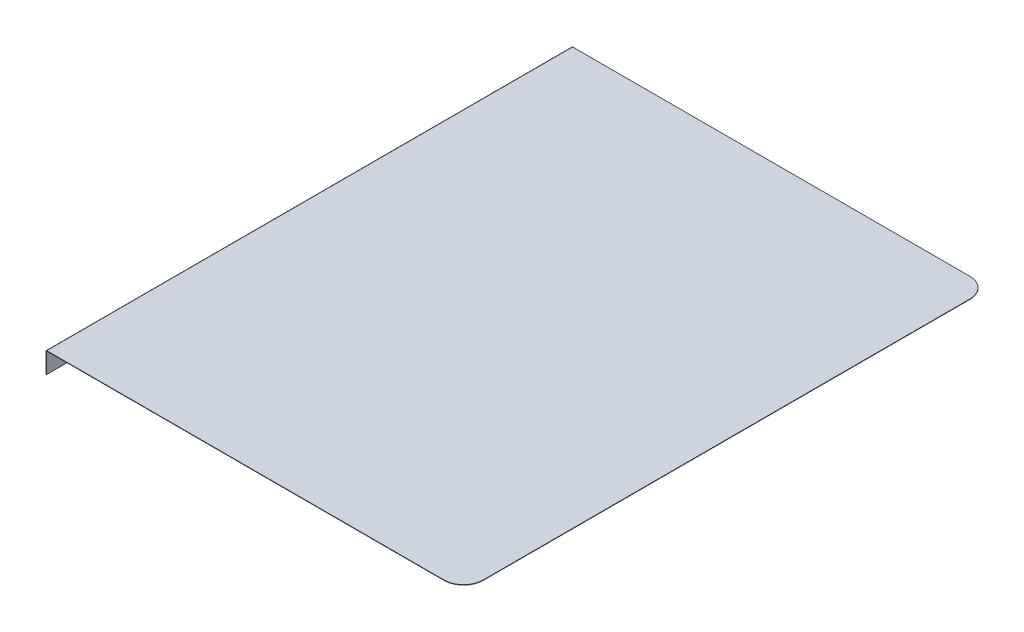
from build123d import *

# Parameters (mm, degrees)
SKETCH1_W                    = 810
SKETCH1_H                    = 1020
BASE_FLANGE1_DEPTH           = 0.8
EDGE_FLANGE1_STRIP_W         = 4.8
EDGE_FLANGE1_STRIP_H         = 0.8
EDGE_FLANGE1_STRIP_CUT_DEPTH = 1020
EDGE_FLANGE1_DEPTH           = 1020
CUT_EXTRUDE2_DEPTH           = 10


# Sheet-metal steps are written as plain solids
with BuildPart() as part:
    # Sketch1 → Base-Flange1 (new body)
    with BuildSketch(Plane(origin=(0, 0, 0), x_dir=(1, 0, 0), z_dir=(0, 1, 0))):
        Rectangle(SKETCH1_W, SKETCH1_H)
    extrude(amount=-BASE_FLANGE1_DEPTH)

    # Edge-Flange1 strip (across the edge) → Edge-Flange1 strip cut (cut)
    with BuildSketch(Plane(origin=(-405, -0.8, 510), x_dir=(1, 0, 0), z_dir=(0, 0, -1))):
        with Locations((-0.8, -0.4)):
            Rectangle(EDGE_FLANGE1_STRIP_W, EDGE_FLANGE1_STRIP_H)
    extrude(amount=EDGE_FLANGE1_STRIP_CUT_DEPTH, mode=Mode.SUBTRACT)

    # Edge-Flange1 section (across the edge) → Edge-Flange1 (add)
    with BuildSketch(Plane(origin=(-405, -0.8, 510), x_dir=(1, 0, 0), z_dir=(0, 0, -1))):
        with BuildLine():
            Line((0, 0.8), (0, 40))
            Line((0, 40), (0.8, 40))
            Line((0.8, 40), (0.8, 0.8))
            ThreePointArc((0.8, 0.8), (1.034314575, 0.234314575), (1.6, 0))
            Line((1.6, 0), (1.6, -0.8))
            ThreePointArc((1.6, -0.8), (0.46862915, -0.33137085), (0, 0.8))
        make_face()
    extrude(amount=EDGE_FLANGE1_DEPTH)

    # Sketch7 → Cut-Extrude2 (cut)
    with BuildSketch(Plane(origin=(0, 0, 0), x_dir=(1, 0, 0), z_dir=(0, 1, 0))):
        with BuildLine():
            Line((405, 510), (367, 510))
            ThreePointArc((367, 510), (393.870057685, 498.870057685), (405, 472))
            Line((405, 472), (405, 510))
        make_face()
        with BuildLine():
            Line((405, -510), (367, -510))
            ThreePointArc((367, -510), (393.870057685, -498.870057685), (405, -472))
            Line((405, -472), (405, -510))
        make_face()
    extrude(amount=-CUT_EXTRUDE2_DEPTH, mode=Mode.SUBTRACT)


solid = part.part
